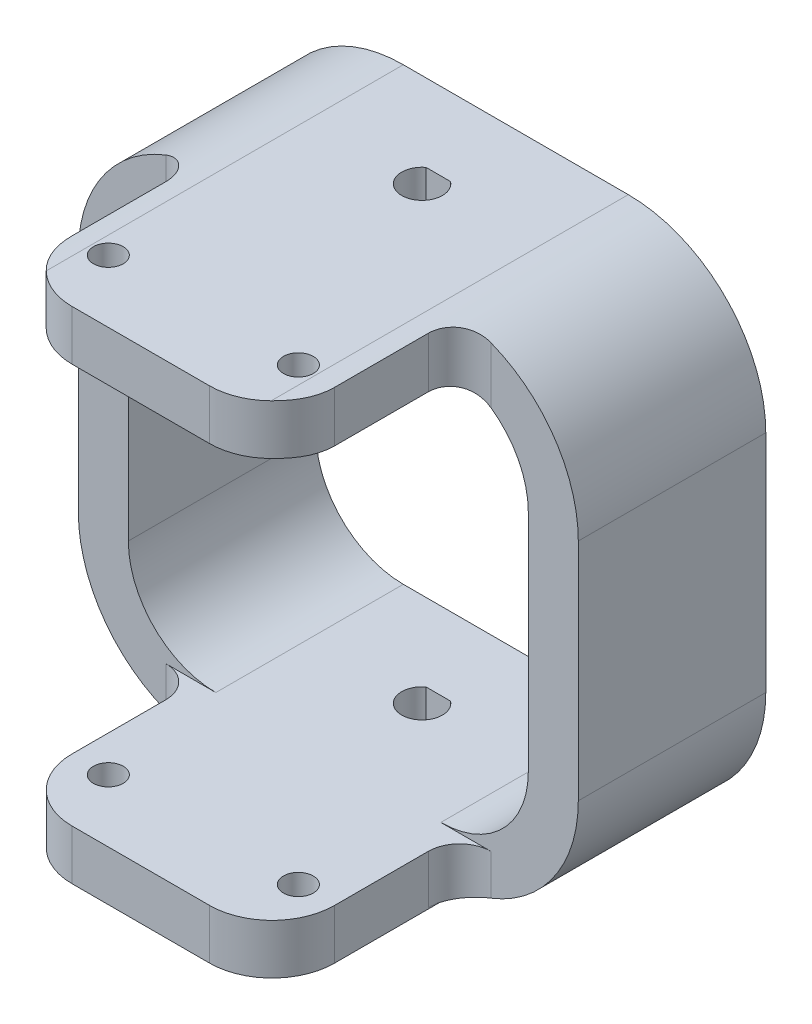
from build123d import *

# Parameters (mm, degrees)
ESQUISSE1_W                             = 80
ESQUISSE1_H                             = 80
ESQUISSE1_W_2                           = 64
ESQUISSE1_H_2                           = 64
BOSS_EXTRU_1_DEPTH                      = 15
ESQUISSE7_W                             = 42
ESQUISSE7_H                             = 8
BOSS_EXTRU_4_DEPTH                      = 30
CONG_2_R                                = 22
CONG_3_R                                = 14
PER_AGE_POUR_CROUS_AUTO_BLOQUANTS_300_D = 4.7625
CONG_1_R                                = 10
CONG_1_OF_SYM_TRIE2_R                   = 10
CONG_4_R                                = 5
ENL_V_MAT_EXTRU_3_DEPTH                 = 124.389626983


with BuildPart() as part:
    # Esquisse1 → Boss.-Extru.1 (new, symmetric)
    with BuildSketch(Plane.XY):
        Rectangle(ESQUISSE1_W, ESQUISSE1_H)
        Rectangle(ESQUISSE1_W_2, ESQUISSE1_H_2, mode=Mode.SUBTRACT)
    extrude(amount=BOSS_EXTRU_1_DEPTH, both=True)

    # Esquisse7 → Boss.-Extru.4 (add)
    with BuildSketch(Plane.XY.offset(15)):
        with Locations((0, 36)):
            Rectangle(ESQUISSE7_W, ESQUISSE7_H)
    boss_extru_4 = extrude(amount=BOSS_EXTRU_4_DEPTH)

    # Congé2
    cong_2_edges = [part.edges().sort_by_distance(p)[0] for p in [
        (40, -40, 0),
        (-40, -40, 0),
        (-40, 40, 0),
        (40, 40, 0),
    ]]
    fillet(cong_2_edges, radius=CONG_2_R)

    # Congé3
    cong_3_edges = [part.edges().sort_by_distance(p)[0] for p in [
        (-32, 32, 0),
        (-32, -32, 0),
        (32, -32, 0),
        (32, 32, 0),
    ]]
    fillet(cong_3_edges, radius=CONG_3_R)

    # Perçage pour écrous auto-bloquants 300® #6 (SP)1 (through all)
    with Locations(Plane(origin=(0, 40, 0), x_dir=(0, 0, -1), z_dir=(0, 1, 0))):
        with Locations((-35, -15.205), (-35, 15.205)):
            per_age_pour_crous_auto_bloquants_300 = Hole(PER_AGE_POUR_CROUS_AUTO_BLOQUANTS_300_D / 2)

    # Congé1
    cong_1_edges = [part.edges().sort_by_distance(p)[0] for p in [
        (21, 35.734644524, 45),
        (-21, 35.734644524, 45),
    ]]
    fillet(cong_1_edges, radius=CONG_1_R)

    # Symétrie2: Boss.-Extru.4, Perçage pour écrous auto-bloquants 300® #6 (SP)1 across plane
    add(boss_extru_4.mirror(Plane.ZX))
    add(per_age_pour_crous_auto_bloquants_300.mirror(Plane.ZX), mode=Mode.SUBTRACT)

    # Congé1 of Symétrie2
    cong_1_of_sym_trie2_edges = [part.edges().sort_by_distance(p)[0] for p in [
        (21, -35.734644524, 45),
        (-21, -35.734644524, 45),
    ]]
    fillet(cong_1_of_sym_trie2_edges, radius=CONG_1_OF_SYM_TRIE2_R)

    # Congé4
    cong_4_edges = [part.edges().sort_by_distance(p)[0] for p in [
        (-21, -35.897247359, 15),
        (-21, 35.734644524, 15),
        (21, -35.897247359, 15),
        (21, 35.734644524, 15),
    ]]
    fillet(cong_4_edges, radius=CONG_4_R)

    # Esquisse11 → Enlèv. mat.-Extru.3 (cut, through all)
    with BuildSketch(Plane(origin=(0, -40, -40), x_dir=(1, 0, 0), z_dir=(0, 1, 0))):
        with BuildLine():
            Line((1.964942747, -37.405), (-1.964942747, -37.405))
            ThreePointArc((-1.964942747, -37.405), (0, -43.255), (1.964942747, -37.405))
        make_face()
    extrude(amount=ENL_V_MAT_EXTRU_3_DEPTH, mode=Mode.SUBTRACT)


solid = part.part
